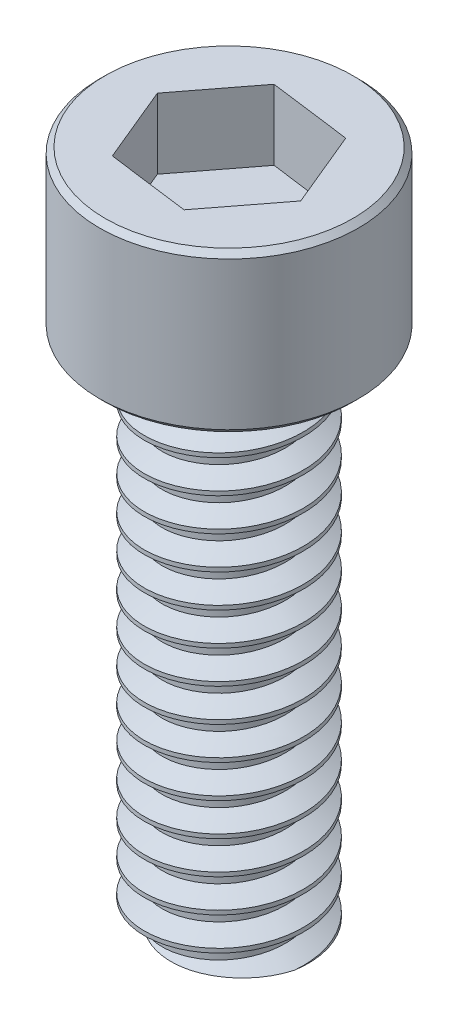
from build123d import *
from build123d.topology import SkipClean

# Parameters (mm, degrees)
SKETCH1_R           = 1.778
BOSS_EXTRUDE1_DEPTH = 2.1844
CHAMFER1_SIZE       = 0.0762
CUT_EXTRUDE1_DEPTH  = 0.9652
SKETCH3_R           = 1.0922
BOSS_EXTRUDE2_DEPTH = 6.985
THREAD1_PITCH       = 0.453571429


with BuildPart() as part:
    # Sketch1 → Boss-Extrude1 (new body)
    with BuildSketch(Plane(origin=(0, 0, 0), x_dir=(1, 0, 0), z_dir=(0, 1, 0))):
        with Locations(Location((0, 0, 0), (0, 0, 270))):
            Circle(SKETCH1_R)
    extrude(amount=BOSS_EXTRUDE1_DEPTH)

    # Chamfer1
    chamfer1_edges = [part.edges().sort_by_distance(p)[0] for p in [
        (0, 0, -1.778),
        (0, 2.1844, -1.778),
    ]]
    chamfer(chamfer1_edges, length=CHAMFER1_SIZE)

    # Sketch2 → Cut-Extrude1 (cut)
    with BuildSketch(Plane(origin=(0, 2.1844, 0), x_dir=(1, 0, 0), z_dir=(0, 1, 0))):
        Polygon((-0.43797602, 1.056674731), (-1.13409517, 0.149039006), (-0.69611915, -0.907635724), (0.43797602, -1.056674731), (1.13409517, -0.149039006), (0.69611915, 0.907635724), align=None)
    extrude(amount=-CUT_EXTRUDE1_DEPTH, mode=Mode.SUBTRACT)

    # Sketch3 → Boss-Extrude2 (add)
    with BuildSketch(Plane.XZ):
        with Locations(Location((0, 0, 0), (0, 0, 270))):
            Circle(SKETCH3_R)
    extrude(amount=BOSS_EXTRUDE2_DEPTH)

    # Thread1: the profile of Thread Profile1 profile screwed along a right-hand helix of 28 turns, 6 arcs to a turn; built about Z, then put on its axis
    with SkipClean():  # the faces are left unmerged after this step: merging them gives an invalid solid
        thread1_z = Axis((0, 0, 0), (0, 0, 1))
        thread1_corners = [(1.0925, 0, -0.000173205), (1.0925, 0, 0.397048204), (0.846697264, 0, 0.255133928), (0.846697264, 0, 0.141741071)]
        with BuildLine(mode=Mode.PRIVATE) as thread1_profile:
            Line(thread1_corners[0], thread1_corners[1])
            Line(thread1_corners[1], thread1_corners[2])
            Line(thread1_corners[2], thread1_corners[3])
            Line(thread1_corners[3], thread1_corners[0])
        thread1_cap = Face(thread1_profile.wire())
        thread1_turn_angles = [0, 30, 60, 90, 120, 150, 180, 210, 240, 270, 300, 330, 360]
        thread1_turn_weights = [1, 0.8660254037844387, 1, 0.8660254037844387, 1, 0.8660254037844387, 1, 0.8660254037844387, 1, 0.8660254037844387, 1, 0.8660254037844387, 1]
        thread1_turn_rails = [Edge.make_bspline([Vector(p[0], p[1], 0).rotate(thread1_z, thread1_turn_angles[k]) / thread1_turn_weights[k] + Vector(0, 0, p[2] + THREAD1_PITCH * thread1_turn_angles[k] / 360) for k in range(13)], [0, 0, 0, 1, 1, 2, 2, 3, 3, 4, 4, 5, 5, 6, 6, 6], 2, thread1_turn_weights) for p in thread1_corners]
        thread1_turn_sides = [Face.make_surface_from_curves(thread1_turn_rails[p[0]], thread1_turn_rails[p[1]]) for p in [(0, 1), (1, 2), (2, 3), (3, 0)]]
        thread1 = Plane(origin=(0, 0, 0), x_dir=(-1, 0, 0), z_dir=(0, -1, 0)) * Solid(Shell([*[p.moved(Location((0, 0, THREAD1_PITCH * i))) for i in range(28) for p in thread1_turn_sides], thread1_cap, thread1_cap.rotate(thread1_z, 10080).moved(Location((0, 0, THREAD1_PITCH * 10080 / 360)))]))
        add(thread1, mode=Mode.SUBTRACT)


solid = part.part
